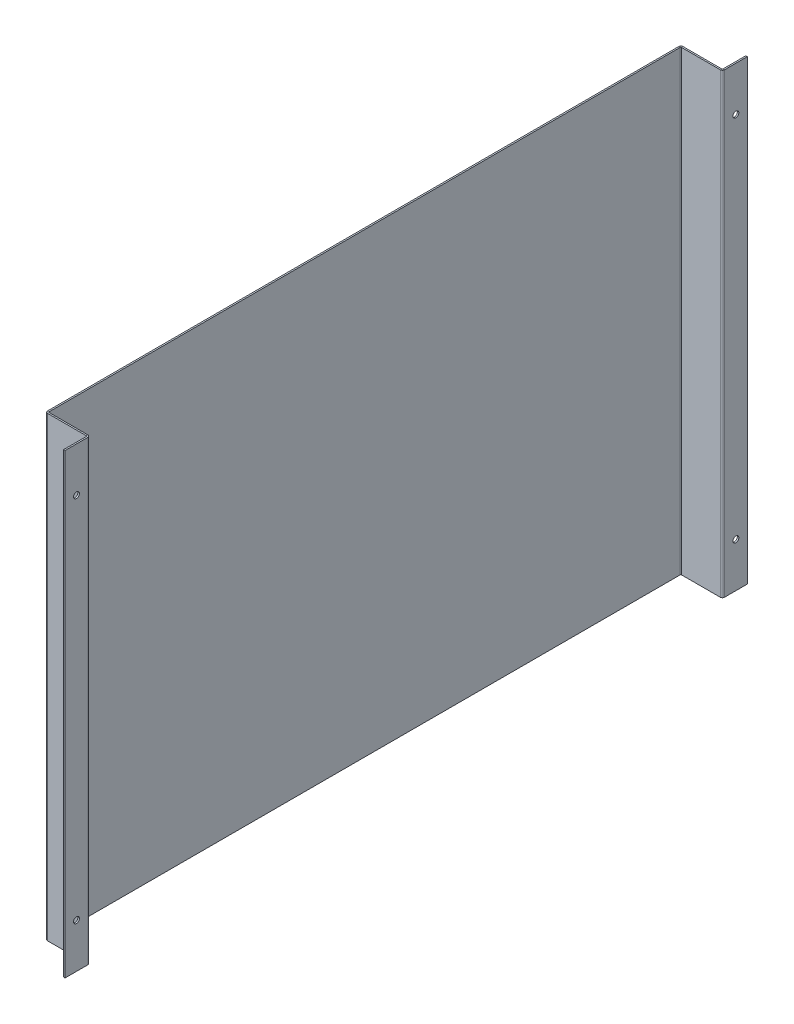
from build123d import *

# Parameters (mm, degrees)
SKETCH1_W                      = 765
SKETCH1_H                      = 550
BASE_FLANGE1_DEPTH             = 1.8
EDGE_FLANGE1_STRIP_W           = 8.6732
EDGE_FLANGE1_STRIP_H           = 1.8
EDGE_FLANGE1_STRIP_CUT_DEPTH   = 550
EDGE_FLANGE1_STRIP_2_W         = 8.6732
EDGE_FLANGE1_STRIP_2_H         = 1.8
EDGE_FLANGE1_STRIP_CUT_2_DEPTH = 550
EDGE_FLANGE1_DEPTH             = 550
EDGE_FLANGE1_BEND_DEPTH        = 550
EDGE_FLANGE2_STRIP_W           = 8.6732
EDGE_FLANGE2_STRIP_H           = 1.8
EDGE_FLANGE2_STRIP_CUT_DEPTH   = 550
EDGE_FLANGE2_STRIP_2_W         = 8.6732
EDGE_FLANGE2_STRIP_2_H         = 1.8
EDGE_FLANGE2_STRIP_CUT_2_DEPTH = 550
EDGE_FLANGE2_DEPTH             = 550
EDGE_FLANGE2_BEND_DEPTH        = 550
SKETCH18_R                     = 3.5
CUT_EXTRUDE1_DEPTH             = 10


# Sheet-metal steps are written as plain solids
with BuildPart() as part:
    # Sketch1 → Base-Flange1 (new body)
    with BuildSketch(Plane(origin=(0, 0, 0), x_dir=(0, 0, -1), z_dir=(1, 0, 0))):
        Rectangle(SKETCH1_W, SKETCH1_H)
    extrude(amount=-BASE_FLANGE1_DEPTH)

    # Edge-Flange1 strip (across the edge) → Edge-Flange1 strip cut (cut)
    with BuildSketch(Plane(origin=(0, 275, 382.5), x_dir=(0, 0, -1), z_dir=(0, -1, 0))):
        with Locations((-1.8, -0.9)):
            Rectangle(EDGE_FLANGE1_STRIP_W, EDGE_FLANGE1_STRIP_H)
    extrude(amount=EDGE_FLANGE1_STRIP_CUT_DEPTH, mode=Mode.SUBTRACT)

    # Edge-Flange1 strip 2 (across the edge) → Edge-Flange1 strip cut 2 (cut)
    with BuildSketch(Plane(origin=(0, -275, -382.5), x_dir=(0, 0, 1), z_dir=(0, 1, 0))):
        with Locations((-1.8, -0.9)):
            Rectangle(EDGE_FLANGE1_STRIP_2_W, EDGE_FLANGE1_STRIP_2_H)
    extrude(amount=EDGE_FLANGE1_STRIP_CUT_2_DEPTH, mode=Mode.SUBTRACT)

    # Edge-Flange1 section (across the edge) → Edge-Flange1 (add)
    with BuildSketch(Plane(origin=(0, 275, 382.5), x_dir=(0, 0, -1), z_dir=(0, -1, 0))):
        with BuildLine():
            Line((0, 0.7366), (0, 48.2))
            Line((0, 48.2), (1.8, 48.2))
            Line((1.8, 48.2), (1.8, 0.7366))
            ThreePointArc((1.8, 0.7366), (2.015745145, 0.215745145), (2.5366, 0))
            Line((2.5366, 0), (2.5366, -1.8))
            ThreePointArc((2.5366, -1.8), (0.742952939, -1.057047061), (0, 0.7366))
        make_face()
    extrude(amount=EDGE_FLANGE1_DEPTH)

    # Edge-Flange1 section 2 (across the edge) → Edge-Flange1 bend (add)
    with BuildSketch(Plane(origin=(0, -275, -382.5), x_dir=(0, 0, 1), z_dir=(0, 1, 0))):
        with BuildLine():
            Line((0, 0.7366), (0, 48.2))
            Line((0, 48.2), (1.8, 48.2))
            Line((1.8, 48.2), (1.8, 0.7366))
            ThreePointArc((1.8, 0.7366), (2.015745145, 0.215745145), (2.5366, 0))
            Line((2.5366, 0), (2.5366, -1.8))
            ThreePointArc((2.5366, -1.8), (0.742952939, -1.057047061), (0, 0.7366))
        make_face()
    extrude(amount=EDGE_FLANGE1_BEND_DEPTH)

    # Edge-Flange2 strip (across the edge) → Edge-Flange2 strip cut (cut)
    with BuildSketch(Plane(origin=(48.2, 275, -382.5), x_dir=(-1, 0, 0), z_dir=(0, -1, 0))):
        with Locations((-3.6, -0.9)):
            Rectangle(EDGE_FLANGE2_STRIP_W, EDGE_FLANGE2_STRIP_H)
    extrude(amount=EDGE_FLANGE2_STRIP_CUT_DEPTH, mode=Mode.SUBTRACT)

    # Edge-Flange2 strip 2 (across the edge) → Edge-Flange2 strip cut 2 (cut)
    with BuildSketch(Plane(origin=(48.2, -275, 382.5), x_dir=(-1, 0, 0), z_dir=(0, 1, 0))):
        with Locations((-3.6, -0.9)):
            Rectangle(EDGE_FLANGE2_STRIP_2_W, EDGE_FLANGE2_STRIP_2_H)
    extrude(amount=EDGE_FLANGE2_STRIP_CUT_2_DEPTH, mode=Mode.SUBTRACT)

    # Edge-Flange2 section (across the edge) → Edge-Flange2 (add)
    with BuildSketch(Plane(origin=(48.2, 275, -382.5), x_dir=(-1, 0, 0), z_dir=(0, -1, 0))):
        with BuildLine():
            Line((-1.8, 0.7366), (-1.8, 28.2))
            Line((-1.8, 28.2), (0, 28.2))
            Line((0, 28.2), (0, 0.7366))
            ThreePointArc((0, 0.7366), (0.215745145, 0.215745145), (0.7366, 0))
            Line((0.7366, 0), (0.7366, -1.8))
            ThreePointArc((0.7366, -1.8), (-1.057047061, -1.057047061), (-1.8, 0.7366))
        make_face()
    extrude(amount=EDGE_FLANGE2_DEPTH)

    # Edge-Flange2 section 2 (across the edge) → Edge-Flange2 bend (add)
    with BuildSketch(Plane(origin=(48.2, -275, 382.5), x_dir=(-1, 0, 0), z_dir=(0, 1, 0))):
        with BuildLine():
            Line((-1.8, 0.7366), (-1.8, 28.2))
            Line((-1.8, 28.2), (0, 28.2))
            Line((0, 28.2), (0, 0.7366))
            ThreePointArc((0, 0.7366), (0.215745145, 0.215745145), (0.7366, 0))
            Line((0.7366, 0), (0.7366, -1.8))
            ThreePointArc((0.7366, -1.8), (-1.057047061, -1.057047061), (-1.8, 0.7366))
        make_face()
    extrude(amount=EDGE_FLANGE2_BEND_DEPTH)

    # Sketch18 → Cut-Extrude1 (cut)
    with BuildSketch(Plane.ZY.offset(-48.2)):
        with Locations((-396.9683, 221.5)):
            Circle(SKETCH18_R)
        with Locations((-396.9683, -221.5)):
            Circle(SKETCH18_R)
    cut_extrude1 = extrude(amount=-CUT_EXTRUDE1_DEPTH, mode=Mode.SUBTRACT)

    # Mirror1: Cut-Extrude1 across plane
    add(cut_extrude1.mirror(Plane.XY), mode=Mode.SUBTRACT)


solid = part.part
